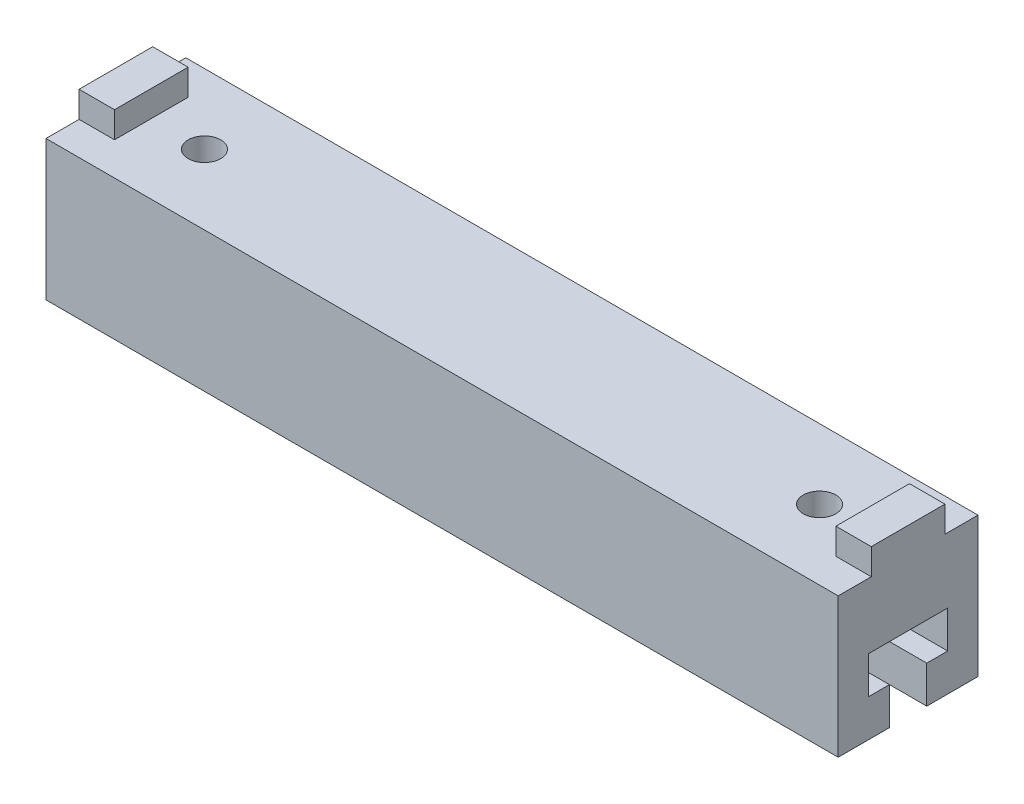
from build123d import *

# Parameters (mm, degrees)
SKETCH1_W               = 85
SKETCH1_H               = 15
BOSS_EXTRUDE1_DEPTH     = 15
SKETCH2_W               = 3.8
SKETCH2_H               = 7.9
BOSS_EXTRUDE2_DEPTH     = 2.8
CUT_EXTRUDE2_DEPTH      = 88.167023581
CUT_EXTRUDE2_DEPTH_BACK = 88.167023581
SKETCH5_R               = 1.75
CUT_EXTRUDE3_DEPTH      = 46.689167206


with BuildPart() as part:
    # Sketch1 → Boss-Extrude1 (new body)
    with BuildSketch(Plane(origin=(0, 0, 0), x_dir=(1, 0, 0), z_dir=(0, 1, 0))):
        Rectangle(SKETCH1_W, SKETCH1_H)
    extrude(amount=BOSS_EXTRUDE1_DEPTH)

    # Sketch2 → Boss-Extrude2 (add)
    with BuildSketch(Plane(origin=(0, 15, 0), x_dir=(1, 0, 0), z_dir=(0, 1, 0))):
        with Locations((-40.6, 0)):
            Rectangle(SKETCH2_W, SKETCH2_H)
        with Locations((40.6, 0)):
            Rectangle(SKETCH2_W, SKETCH2_H)
    extrude(amount=BOSS_EXTRUDE2_DEPTH)

    # Sketch3 → Cut-Extrude2 (cut, two sides: drawn at the far end of the back side and taken through both)
    with BuildSketch(Plane(origin=(42.5, 0, 0), x_dir=(0, 0, -1), z_dir=(1, 0, 0)).offset(-CUT_EXTRUDE2_DEPTH_BACK)):
        Polygon((-2, 0), (2, 0), (2, 4), (4.25, 4), (4.25, 8), (-4.25, 8), (-4.25, 4), (-2, 4), align=None)
    extrude(amount=CUT_EXTRUDE2_DEPTH + CUT_EXTRUDE2_DEPTH_BACK, mode=Mode.SUBTRACT)

    # Sketch5 → Cut-Extrude3 (cut, through all)
    with BuildSketch(Plane(origin=(0, 15, 0), x_dir=(1, 0, 0), z_dir=(0, 1, 0))):
        with Locations((33, 0)):
            Circle(SKETCH5_R)
        with Locations((-33, 0)):
            Circle(SKETCH5_R)
    extrude(amount=-CUT_EXTRUDE3_DEPTH, mode=Mode.SUBTRACT)


solid = part.part
